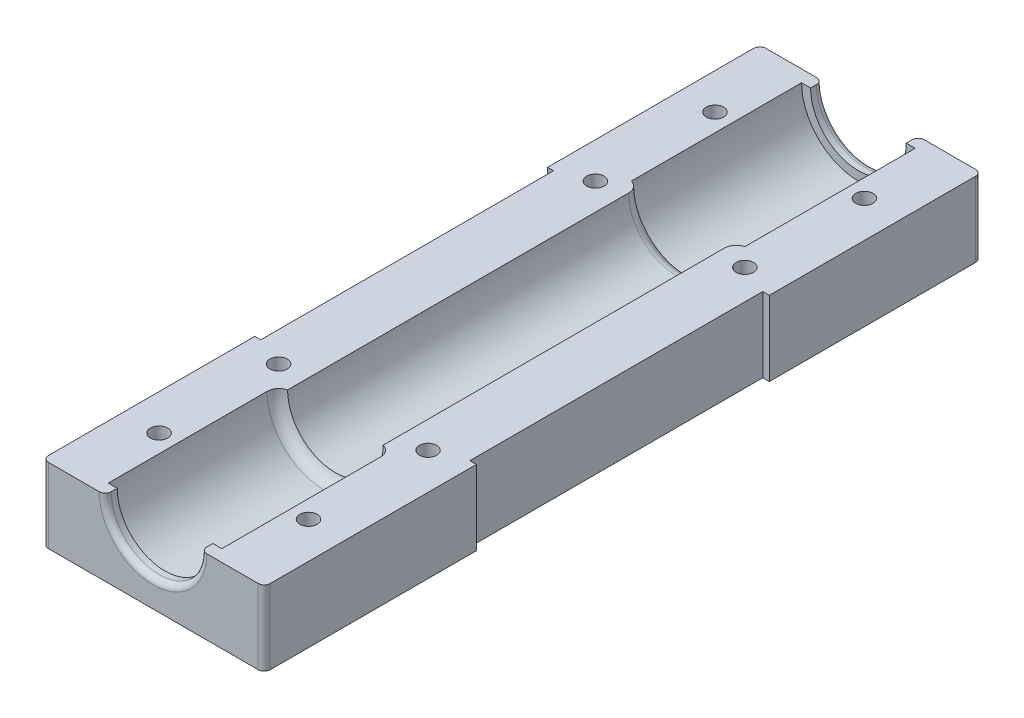
from build123d import *
from build123d.topology import SkipClean

# Parameters (mm, degrees)
BOSS_EXTRUDE1_DEPTH      = 41
BOSS_EXTRUDE1_DEPTH_BACK = 18
SKETCH2_R                = 8.000000000000004
SKETCH3_R                = 9.5
BOSS_EXTRUDE2_DEPTH      = 28.5
BOSS_EXTRUDE3_DEPTH      = 5
BOSS_EXTRUDE4_DEPTH      = 25.451834
M3_5_TAPPED_HOLE1_D      = 2.9
FILLET2_R                = 2
SKETCH14_R               = 8.000000000000004
BOSS_EXTRUDE5_DEPTH      = 2
FILLET10_R               = 1
FILLET10_OF_MIRROR2_R    = 1
FILLET11_R               = 1
FILLET12_R               = 2
SKETCH15_W               = 47.04564696040835
SKETCH15_H               = 19.155839546122916
CUT_EXTRUDE2_DEPTH       = 123.75548779255048
SKETCH16_W               = 50.32184914639417
SKETCH16_H               = 9.010919354068848
CUT_EXTRUDE3_DEPTH       = 123.68683594132897


# Some blends are built 0.0001 mm under size
with BuildPart() as part:
    # Sketch2 → Boss-Extrude1 (new, two sides: drawn at the far end of the back side and taken through both)
    with BuildSketch(Plane.XY.offset(-BOSS_EXTRUDE1_DEPTH_BACK)):
        with BuildLine():
            Line((-12.5, -12.500000000000002), (12.5, -12.500000000000002))
            Line((12.5, -12.500000000000002), (12.5, 5.999999999999994))
            Line((12.5, 5.999999999999994), (12.5, 12.951833846988604))
            ThreePointArc((12.5, 12.951833846988604), (9.463639319119588, 15.311418315675832), (5.995365002334926, 16.97220075561143))
            Line((5.995365002334926, 16.97220075561143), (-1.0000000000000027, 16.97220075561143))
            Line((-1.0000000000000027, 16.97220075561143), (-5.995365002334937, 16.972200755611425))
            ThreePointArc((-5.995365002334937, 16.972200755611425), (-9.463639319119597, 15.311418315675827), (-12.5, 12.951833846988608))
            Line((-12.5, 12.951833846988608), (-12.5, 6.000000000000001))
            Line((-12.5, 6.000000000000001), (-12.5, -12.500000000000002))
        make_face()
        Circle(SKETCH2_R, mode=Mode.SUBTRACT)
    extrude(amount=BOSS_EXTRUDE1_DEPTH + BOSS_EXTRUDE1_DEPTH_BACK)

    # Sketch3 → Boss-Extrude2 (add)
    with BuildSketch(Plane.XY.offset(41)):
        with BuildLine():
            Line((-1.0000000000000016, 17.97498435543818), (0.727272727272726, 17.97498435543818))
            Line((0.727272727272726, 17.97498435543818), (8.769260939312526, 17.974984355438174))
            ThreePointArc((8.769260939312526, 17.974984355438174), (11.304195151298408, 16.498944571740374), (13.595959595959597, 14.667988364633844))
            Line((13.595959595959597, 14.667988364633844), (13.595959595959597, 6.224872228225638))
            Line((13.595959595959597, 6.224872228225638), (13.595959595959597, -12.5))
            Line((13.595959595959597, -12.5), (-13.500000000000002, -12.500000000000004))
            Line((-13.500000000000002, -12.500000000000004), (-13.500000000000002, 6.223411383455548))
            Line((-13.500000000000002, 6.223411383455548), (-13.500000000000002, 14.756354563373698))
            ThreePointArc((-13.500000000000002, 14.756354563373698), (-11.250328445445001, 16.535722236104803), (-8.769260939312526, 17.97498435543818))
            Line((-8.769260939312526, 17.97498435543818), (-1.0000000000000016, 17.97498435543818))
        make_face()
        with Locations(Location((-1.73e-15, 0, 0), (0, 0, 180))):
            Circle(SKETCH3_R, mode=Mode.SUBTRACT)
    boss_extrude2 = extrude(amount=BOSS_EXTRUDE2_DEPTH)

    # Mirror1: Boss-Extrude2 across plane
    add(boss_extrude2.mirror(Plane.XY.offset(11.5)))

    # Sketch4 → Boss-Extrude3 (add)
    with BuildSketch(Plane.XZ.offset(12.500000000000002)):
        Polygon((-13.500000000000002, 41), (-13.500000000000002, 69.5), (-18.500000000000004, 69.5), (-18.500000000000004, 42.75), (-18.500000000000004, 36.00000000000001), (-17.5, 36.00000000000001), (-17.5, -13), (-18.500000000000004, -13.000000000000002), (-18.500000000000004, -46.5), (-13.500000000000002, -46.5), (-13.500000000000002, -18.000000000000004), (-12.499999999999998, -18.000000000000004), (-12.5, 41), align=None)
        Polygon((18.595959595959595, 69.5), (13.595959595959597, 69.5), (13.595959595959597, 41), (12.5, 41), (12.5, -18.000000000000004), (13.595959595959597, -18.000000000000004), (13.595959595959597, -46.5), (18.5959595959596, -46.5), (18.595959595959595, -13), (17.5, -13.000000000000002), (17.5, 36.00000000000001), (18.595959595959595, 36.00000000000001), (18.595959595959595, 42.75), align=None)
        Polygon((13.595959595959597, -18.000000000000004), (12.5, -18.000000000000004), (12.5, 41), (13.595959595959597, 41), (13.595959595959597, 69.5), (-13.500000000000002, 69.5), (-13.500000000000002, 41), (-12.5, 41), (-12.499999999999998, -18.000000000000004), (-13.500000000000002, -18.000000000000004), (-13.500000000000002, -46.5), (13.595959595959597, -46.5), align=None)
    extrude(amount=BOSS_EXTRUDE3_DEPTH)

    # Sketch5 → Boss-Extrude4 (add)
    with BuildSketch(Plane(origin=(0, -12.500000000000002, 0), x_dir=(1, 0, 0), z_dir=(0, 1, 0))):
        Polygon((13.595959595959597, -41), (13.595959595959597, -69.5), (18.595959595959595, -69.5), (18.595959595959595, -36.00000000000001), (17.5, -36.00000000000001), (17.5, 13.000000000000002), (18.595959595959595, 13.000000000000002), (18.595959595959595, 46.5), (13.595959595959597, 46.5), (13.595959595959597, 18.000000000000004), (12.5, 18.000000000000004), (12.5, -41), align=None)
        Polygon((-18.500000000000004, -69.5), (-13.500000000000002, -69.5), (-13.500000000000002, -41), (-12.5, -41), (-12.499999999999998, 18.000000000000004), (-13.500000000000002, 18.000000000000004), (-13.500000000000002, 46.5), (-18.5, 46.5), (-18.500000000000004, 13.000000000000002), (-17.5, 13.000000000000002), (-17.5, -36.00000000000001), (-18.500000000000004, -36.00000000000001), align=None)
    extrude(amount=BOSS_EXTRUDE4_DEPTH)

    # M3.5 Tapped Hole1 (through all)
    with Locations(Plane(origin=(-1.179e-14, 16.97220075561143, 0), x_dir=(1, 6.9e-16, 0), z_dir=(-6.9e-16, 1, 0))):
        with Locations((-12.5, 15), (12.5, 15), (12.5, 35), (-12.5, 35)):
            m3_5_tapped_hole1 = Hole(M3_5_TAPPED_HOLE1_D / 2)

    # Fillet2
    fillet2_edges = [part.edges().sort_by_distance(p)[0] for p in [
        (18.595959595959595, 12.951834, -29.75),
        (-18.5, 12.951834, -29.75),
    ]]
    fillet(fillet2_edges, radius=FILLET2_R - 0.0001)  # a hair under: the kernel refuses the full size

    # Sketch14 → Boss-Extrude5 (add)
    with SkipClean():  # the faces are left unmerged after this step: merging them gives an invalid solid
        with BuildSketch(Plane.XY.offset(69.5)):
            with BuildLine():
                Line((13.595959595959597, 12.951833846988603), (-13.500000000000002, 12.951833846988603))
                Line((-13.500000000000002, 12.951833846988603), (-16.5, 12.951833846988603))
                ThreePointArc((-16.5, 12.951833846988604), (-17.914213562373096, 12.366047409361698), (-18.5, 10.951833846988603))
                Line((-18.500000000000004, 10.951833846988603), (-18.500000000000004, -17.5))
                Line((-18.500000000000004, -17.5), (18.595959595959595, -17.5))
                Line((18.595959595959595, -17.5), (18.595959595959595, 10.951833846988603))
                ThreePointArc((18.595959595959595, 10.951833846988603), (18.01017315833269, 12.366047409361698), (16.595959595959595, 12.951833846988603))
                Line((16.595959595959595, 12.951833846988604), (13.595959595959597, 12.951833846988603))
            make_face()
            Circle(SKETCH14_R, mode=Mode.SUBTRACT)
        boss_extrude5 = extrude(amount=BOSS_EXTRUDE5_DEPTH)

    # Fillet10
    fillet10_edges = [part.edges().sort_by_distance(p)[0] for p in [
        (0.04797979797979934, 12.951833846988603, 71.5),
        (-8.000000000000004, 9.8e-16, 71.5),
        (-17.914213562373096, 12.366047409361698, 71.5),
        (-18.500000000000004, -3.2740830765056987, 71.5),
        (0.04797979797979579, -17.5, 71.5),
        (18.595959595959595, -3.2740830765056987, 71.5),
        (18.01017315833269, 12.366047409361698, 71.5),
    ]]
    fillet(fillet10_edges, radius=FILLET10_R)

    # Mirror2: Boss-Extrude5 across plane
    with SkipClean():  # the faces are left unmerged after this step: merging them gives an invalid solid
        add(boss_extrude5.mirror(Plane.XY.offset(11.5)))

    # Fillet10 of Mirror2
    fillet10_of_mirror2_edges = [part.edges().sort_by_distance(p)[0] for p in [
        (0.04797979797979934, 12.951833846988603, -48.5),
        (-8.000000000000004, 9.8e-16, -48.5),
        (-17.914213562373096, 12.366047409361698, -48.5),
        (-18.500000000000004, -3.2740830765056987, -48.5),
        (0.04797979797979579, -17.5, -48.5),
        (18.595959595959595, -3.2740830765056987, -48.5),
        (18.01017315833269, 12.366047409361698, -48.5),
    ]]
    fillet(fillet10_of_mirror2_edges, radius=FILLET10_OF_MIRROR2_R)

    # Fillet11
    fillet11_edges = [part.edges().sort_by_distance(p)[0] for p in [
        (11.304195151298412, 16.498944571740378, 69.5),
        (1.78e-15, 17.974984355438178, 69.5),
        (-11.250328445445, 16.535722236104803, 69.5),
        (-11.250328445445, 16.535722236104803, -46.5),
        (1.78e-15, 17.974984355438178, -46.5),
        (11.304195151298412, 16.498944571740378, -46.5),
    ]]
    fillet(fillet11_edges, radius=FILLET11_R)

    # Fillet12
    # the kernel refuses this fillet: 2 mm, written as the material it adds along each edge
    with BuildSketch(Plane(origin=(-1.73e-15, 0, 41), x_dir=(-1, 1.2e-16, 0), z_dir=(1.2e-16, 1, 0))) as fillet12_piece_1:
        with BuildLine():
            CenterArc((7.5, 1.9364916731037098), FILLET12_R, 284.47751218593, 75.52248781407002)
            Line((8.000000000000004, 0), (8.010000000000003, -0.03872983346207093))
            ThreePointArc((8.010000000000003, -0.03872983346207093), (8.750000000000002, -0.03999999999999915), (9.5, -0.03999999999999915))
            Line((9.5, -0.03999999999999915), (9.54, 0))
            Line((9.54, 0), (9.54, 1.9364916731037098))
            Line((9.54, 1.9364916731037098), (9.5, 1.9364916731037098))
        make_face()
    revolve(axis=Axis((-1.73e-15, 0, 41), (0, 0, 1)))
    # the kernel refuses this fillet: 2 mm, written as the material it takes off along each edge
    with BuildSketch(Plane(origin=(-1.73e-15, 0, -18), x_dir=(1, 0, 0), z_dir=(0, -1, 0))) as fillet12_2_piece_1:
        with BuildLine():
            CenterArc((10.000000000000004, 1.9364916731037063), FILLET12_R, 180, 75.52248781406996)
            Line((8.000000000000004, 1.9364916731037063), (7.9600000000000035, 1.9364916731037063))
            Line((7.9600000000000035, 1.9364916731037063), (7.9600000000000035, 0))
            Line((7.9600000000000035, 0), (8.000000000000004, -0.03999999999999915))
            ThreePointArc((8.000000000000004, -0.03999999999999915), (8.750000000000002, -0.03999999999999915), (9.49, -0.03872983346207448))
            Line((9.49, -0.03872983346207448), (9.5, 0))
        make_face()
    revolve(axis=Axis((-1.73e-15, 0, -18), (0, 0, 1)), mode=Mode.SUBTRACT)

    # Mirror3: M3.5 Tapped Hole1 across plane
    with SkipClean():  # the faces are left unmerged after this step: merging them gives an invalid solid
        add(m3_5_tapped_hole1.mirror(Plane.XY.offset(11.5)), mode=Mode.SUBTRACT)

    # Sketch15 → Cut-Extrude2 (cut, through all)
    with BuildSketch(Plane.XY.offset(71.50000000000001)):
        with Locations((2.6415149640881275, 9.577919773061458)):
            Rectangle(SKETCH15_W, SKETCH15_H)
    extrude(amount=-CUT_EXTRUDE2_DEPTH, mode=Mode.SUBTRACT)

    # Sketch16 → Cut-Extrude3 (cut, through all)
    with BuildSketch(Plane(origin=(0, 0, -48.50000000000001), x_dir=(-1, 0, 0), z_dir=(0, 0, -1))):
        with Locations((0.38733031574332877, -17.005459677034427)):
            Rectangle(SKETCH16_W, SKETCH16_H)
    extrude(amount=-CUT_EXTRUDE3_DEPTH, mode=Mode.SUBTRACT)


solid = part.part
